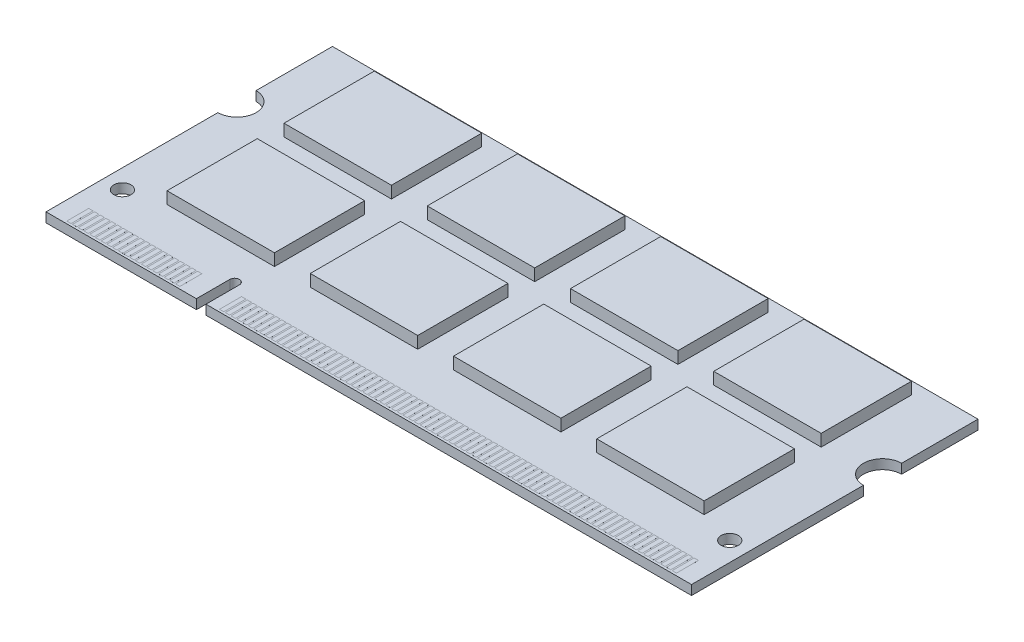
from build123d import *

# Parameters (mm, degrees)
SKETCH1_W             = 67.6
SKETCH1_H             = 30
EXTRUDE1_DEPTH        = 0.5
SKETCH2_R             = 0.9
CUT_EXTRUDE1_DEPTH    = 46.204424562
CUT_EXTRUDE2_DEPTH    = 46.204424562
SKETCH4_R             = 2
CUT_EXTRUDE3_DEPTH    = 46.204424562
SKETCH6_W             = 0.45
SKETCH6_H             = 2.3
EXTRUDE3_DEPTH        = 0.001
SKETCH7_W             = 0.45
SKETCH7_H             = 2.3
EXTRUDE4_DEPTH        = 0.001
LPATTERN2_COUNT       = 80
LPATTERN2_PITCH       = 0.6
SKETCH5_W             = 0.45
SKETCH5_H             = 2.3
EXTRUDE2_DEPTH        = 0.001
SKETCH8_W             = 0.45
SKETCH8_H             = 2.3
EXTRUDE5_DEPTH        = 0.001
LPATTERN1_COUNT       = 20
LPATTERN1_PITCH       = 0.6
SKETCH9_W             = 11.25
SKETCH9_H             = 9.45
EXTRUDE6_DEPTH        = 1.25
SKETCH10_W            = 11.25
SKETCH10_H            = 9.45
EXTRUDE7_DEPTH        = 1.25
LPATTERN3_START       = -13.125005
LPATTERN3_OUTLINE_W   = 1.25
LPATTERN3_OUTLINE_H   = 9.45
LPATTERN3_DEPTH       = 11.25
LPATTERN3_START_2     = 1.874995
LPATTERN3_2_OUTLINE_W = 1.25
LPATTERN3_2_OUTLINE_H = 9.45
LPATTERN3_2_DEPTH     = 11.25
LPATTERN3_START_3     = 16.874995
LPATTERN3_3_OUTLINE_W = 1.25
LPATTERN3_3_OUTLINE_H = 9.45
LPATTERN3_3_DEPTH     = 11.25
LPATTERN3_START_4     = -28.125005
LPATTERN3_4_OUTLINE_W = 1.25
LPATTERN3_4_OUTLINE_H = 9.45
LPATTERN3_4_DEPTH     = 11.25


# Read off the part's stored shape, not the designer's step: LPattern3
with BuildPart() as part:
    # Sketch1 → Extrude1 (new, symmetric)
    with BuildSketch(Plane(origin=(0, 0, 0), x_dir=(1, 0, 0), z_dir=(0, 1, 0))):
        with Locations((0, 15)):
            Rectangle(SKETCH1_W, SKETCH1_H)
    extrude(amount=EXTRUDE1_DEPTH, both=True)

    # Sketch2 → Cut-Extrude1 (cut, through all)
    with BuildSketch(Plane(origin=(0, 0.5, 0), x_dir=(-1, 0, 0), z_dir=(0, 1, 0))):
        with Locations(Location((31.8, -6, 0), (0, 0, 90))):
            Circle(SKETCH2_R)
        with Locations(Location((-31.8, -6, 0), (0, 0, 90))):
            Circle(SKETCH2_R)
    extrude(amount=-CUT_EXTRUDE1_DEPTH, mode=Mode.SUBTRACT)

    # Sketch3 → Cut-Extrude2 (cut, through all)
    with BuildSketch(Plane(origin=(0, 0.5, 0), x_dir=(-1, 0, 0), z_dir=(0, 1, 0))):
        with BuildLine():
            Line((18.05, -3.5), (18.05, 0))
            Line((18.05, 0), (17.05, 0))
            Line((17.05, 0), (17.05, -3.5))
            ThreePointArc((17.05, -3.5), (17.55, -4), (18.05, -3.5))
        make_face()
    extrude(amount=-CUT_EXTRUDE2_DEPTH, mode=Mode.SUBTRACT)

    # Sketch4 → Cut-Extrude3 (cut, through all)
    with BuildSketch(Plane.XZ.offset(0.5)):
        with Locations((-33.8, -20)):
            Circle(SKETCH4_R)
        with Locations((33.8, -20)):
            Circle(SKETCH4_R)
    extrude(amount=-CUT_EXTRUDE3_DEPTH, mode=Mode.SUBTRACT)

    # Sketch6 → Extrude3 (add)
    with BuildSketch(Plane.XZ.offset(0.5)):
        with Locations((-15.35, -1.4)):
            Rectangle(SKETCH6_W, SKETCH6_H)
    extrude3 = extrude(amount=EXTRUDE3_DEPTH)

    # Sketch7 → Extrude4 (add)
    with BuildSketch(Plane(origin=(0, 0.5, 0), x_dir=(-1, 0, 0), z_dir=(0, 1, 0))):
        with Locations((15.65, -1.4)):
            Rectangle(SKETCH7_W, SKETCH7_H)
    extrude4 = extrude(amount=EXTRUDE4_DEPTH)

    # LPattern2: Extrude3, Extrude4 ×80
    with Locations(*[(i * LPATTERN2_PITCH, 0, 0) for i in range(1, LPATTERN2_COUNT)]):
        add(extrude3)
        add(extrude4)

    # Sketch5 → Extrude2 (add)
    with BuildSketch(Plane.XZ.offset(0.5)):
        with Locations((-19.95, -1.4)):
            Rectangle(SKETCH5_W, SKETCH5_H)
    extrude2 = extrude(amount=EXTRUDE2_DEPTH)

    # Sketch8 → Extrude5 (add)
    with BuildSketch(Plane(origin=(0, 0.5, 0), x_dir=(-1, 0, 0), z_dir=(0, 1, 0))):
        with Locations((20.25, -1.4)):
            Rectangle(SKETCH8_W, SKETCH8_H)
    extrude5 = extrude(amount=EXTRUDE5_DEPTH)

    # LPattern1: Extrude2, Extrude5 ×20
    with Locations(*[(-i * LPATTERN1_PITCH, 0, 0) for i in range(1, LPATTERN1_COUNT)]):
        add(extrude2)
        add(extrude5)

    # LPattern3 outline → LPattern3 (add)
    with BuildSketch(Plane.YZ.offset(LPATTERN3_START)):
        with Locations((1.125, -23.975)):
            Rectangle(LPATTERN3_OUTLINE_W, LPATTERN3_OUTLINE_H)
        with Locations((1.125, -11.725)):
            Rectangle(LPATTERN3_OUTLINE_W, LPATTERN3_OUTLINE_H)
        with Locations((-1.125, -11.725)):
            Rectangle(LPATTERN3_OUTLINE_W, LPATTERN3_OUTLINE_H)
        with Locations((-1.125, -23.975)):
            Rectangle(LPATTERN3_OUTLINE_W, LPATTERN3_OUTLINE_H)
    extrude(amount=LPATTERN3_DEPTH)

    # LPattern3 2 outline → LPattern3 2 (add)
    with BuildSketch(Plane.YZ.offset(LPATTERN3_START_2)):
        with Locations((1.125, -23.975)):
            Rectangle(LPATTERN3_2_OUTLINE_W, LPATTERN3_2_OUTLINE_H)
        with Locations((1.125, -11.725)):
            Rectangle(LPATTERN3_2_OUTLINE_W, LPATTERN3_2_OUTLINE_H)
        with Locations((-1.125, -11.725)):
            Rectangle(LPATTERN3_2_OUTLINE_W, LPATTERN3_2_OUTLINE_H)
        with Locations((-1.125, -23.975)):
            Rectangle(LPATTERN3_2_OUTLINE_W, LPATTERN3_2_OUTLINE_H)
    extrude(amount=LPATTERN3_2_DEPTH)

    # LPattern3 3 outline → LPattern3 3 (add)
    with BuildSketch(Plane.YZ.offset(LPATTERN3_START_3)):
        with Locations((1.125, -23.975)):
            Rectangle(LPATTERN3_3_OUTLINE_W, LPATTERN3_3_OUTLINE_H)
        with Locations((1.125, -11.725)):
            Rectangle(LPATTERN3_3_OUTLINE_W, LPATTERN3_3_OUTLINE_H)
        with Locations((-1.125, -11.725)):
            Rectangle(LPATTERN3_3_OUTLINE_W, LPATTERN3_3_OUTLINE_H)
        with Locations((-1.125, -23.975)):
            Rectangle(LPATTERN3_3_OUTLINE_W, LPATTERN3_3_OUTLINE_H)
    extrude(amount=LPATTERN3_3_DEPTH)

    # LPattern3 4 outline → LPattern3 4 (add)
    with BuildSketch(Plane.YZ.offset(LPATTERN3_START_4)):
        with Locations((1.125, -23.975)):
            Rectangle(LPATTERN3_4_OUTLINE_W, LPATTERN3_4_OUTLINE_H)
        with Locations((-1.125, -23.975)):
            Rectangle(LPATTERN3_4_OUTLINE_W, LPATTERN3_4_OUTLINE_H)
    extrude(amount=LPATTERN3_4_DEPTH)


with BuildPart() as body_2:
    # Sketch9 → Extrude6 (new body)
    with BuildSketch(Plane(origin=(0, 0.5, 0), x_dir=(1, 0, 0), z_dir=(0, 1, 0))):
        with Locations((-22.500005, 11.725)):
            Rectangle(SKETCH9_W, SKETCH9_H)
    extrude(amount=EXTRUDE6_DEPTH)


with BuildPart() as body_3:
    # Sketch10 → Extrude7 (new body)
    with BuildSketch(Plane.XZ.offset(0.5)):
        with Locations((-22.500005, -11.725)):
            Rectangle(SKETCH10_W, SKETCH10_H)
    extrude(amount=EXTRUDE7_DEPTH)


solid = Compound([part.part, body_2.part, body_3.part])
